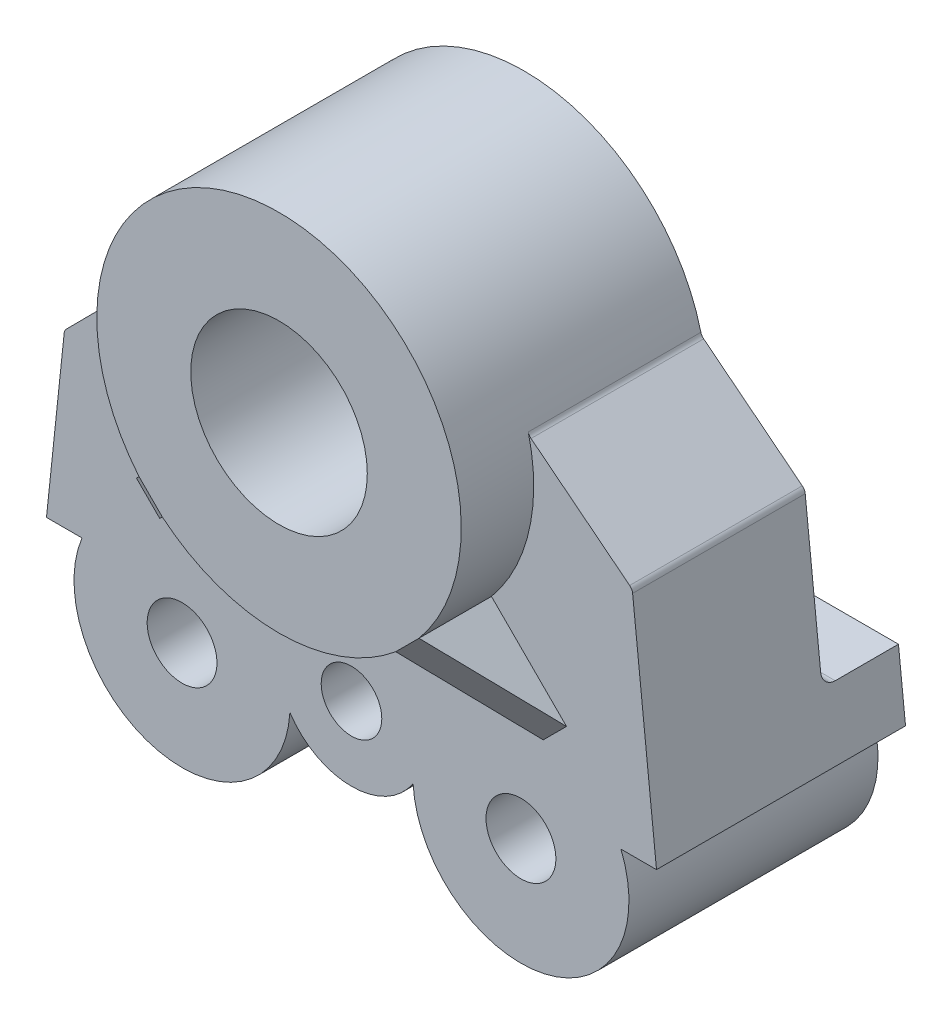
from build123d import *

# Parameters (mm, degrees)
SALIENTE_EXTRUIR1_DEPTH      = 6.7
SALIENTE_EXTRUIR1_DEPTH_BACK = 5.5
CORTAR_EXTRUIR1_REACH        = 25.161
CROQUIS3_R                   = 3.35
CROQUIS3_R_2                 = 2.69
CROQUIS3_R_3                 = 1.15
CORTAR_EXTRUIR3_START        = -2.9
CORTAR_EXTRUIR3_DEPTH        = 2.9
CORTAR_EXTRUIR4_DEPTH        = 2.75
CROQUIS7_R                   = 4.1
CROQUIS7_R_2                 = 1.325
SALIENTE_EXTRUIR2_DEPTH      = 2.03
REDONDEO3_R                  = 0.5
REDONDEO4_R                  = 0.3
REDONDEO5_START              = -2.75
REDONDEO5_DEPTH              = 6.55
REDONDEO6_R                  = 0.3
REDONDEO7_R                  = 0.3
SALIENTE_EXTRUIR3_START      = 2.75
SALIENTE_EXTRUIR3_DEPTH      = 2.75
CORTAR_EXTRUIR5_REACH        = 23.382
CORTAR_EXTRUIR6_REACH        = 23.382
CROQUIS11_W                  = 25.480274204
CROQUIS11_H                  = 24.941512188
CORTAR_EXTRUIR7_DEPTH        = 33


with BuildPart() as part:
    # Croquis2 → Saliente-Extruir1 (new, two sides: drawn at the far end of the back side and taken through both)
    with BuildSketch(Plane.XY.offset(-SALIENTE_EXTRUIR1_DEPTH_BACK)):
        with BuildLine():
            Line((11.575, -10.275), (10.225721275, -10.275))
            ThreePointArc((10.225721275, -10.275), (7.338229527, -15.823139458), (2.337147732, -12.066992374))
            ThreePointArc((2.337147732, -12.066992374), (0, -13.325), (-2.337147732, -12.066992374))
            ThreePointArc((-2.337147732, -12.066992374), (-7.338229527, -15.823139458), (-10.225721275, -10.275))
            Line((-10.225721275, -10.275), (-11.575, -10.275))
            Line((-11.575, -10.275), (-10.892429135, -3.780772023))
            Line((-10.892429135, -3.780772023), (-6.911230699, 0.228287594))
            ThreePointArc((-6.911230699, 0.228287594), (-0.680469648, 6.88143779), (6.732669496, 1.577462032))
            Line((6.732669496, 1.577462032), (10.655149523, -1.523207321))
            Line((10.655149523, -1.523207321), (11.575, -10.275))
        make_face()
    extrude(amount=SALIENTE_EXTRUIR1_DEPTH + SALIENTE_EXTRUIR1_DEPTH_BACK)

    # Croquis3 → Cortar-Extruir1 (cut, up to next)
    with BuildSketch(Plane.XY.offset(6.7), mode=Mode.PRIVATE) as cortar_extruir1_sk1:
        Circle(CROQUIS3_R)
    cortar_extruir1_tool1 = extrude(cortar_extruir1_sk1.sketch, amount=-CORTAR_EXTRUIR1_REACH, mode=Mode.PRIVATE) & part.part
    # Croquis3 → Cortar-Extruir1 (cut, up to next)
    with BuildSketch(Plane.XY.offset(6.7), mode=Mode.PRIVATE) as cortar_extruir1_sk2:
        with Locations((6.43, -11.825)):
            Circle(CROQUIS3_R_2)
    cortar_extruir1_tool2 = extrude(cortar_extruir1_sk2.sketch, amount=-CORTAR_EXTRUIR1_REACH, mode=Mode.PRIVATE) & part.part
    # Croquis3 → Cortar-Extruir1 (cut, up to next)
    with BuildSketch(Plane.XY.offset(6.7), mode=Mode.PRIVATE) as cortar_extruir1_sk3:
        with Locations((-6.43, -11.825)):
            Circle(CROQUIS3_R_2)
    cortar_extruir1_tool3 = extrude(cortar_extruir1_sk3.sketch, amount=-CORTAR_EXTRUIR1_REACH, mode=Mode.PRIVATE) & part.part
    # Croquis3 → Cortar-Extruir1 (cut, up to next)
    with BuildSketch(Plane.XY.offset(6.7), mode=Mode.PRIVATE) as cortar_extruir1_sk4:
        with Locations((0, -10.525)):
            Circle(CROQUIS3_R_3)
    cortar_extruir1_tool4 = extrude(cortar_extruir1_sk4.sketch, amount=-CORTAR_EXTRUIR1_REACH, mode=Mode.PRIVATE) & part.part
    add(cortar_extruir1_tool1.solids().sort_by_distance((0, 0, 6.7))[0], mode=Mode.SUBTRACT)
    add(cortar_extruir1_tool2.solids().sort_by_distance((6.43, -11.825, 6.7))[0], mode=Mode.SUBTRACT)
    add(cortar_extruir1_tool3.solids().sort_by_distance((-6.43, -11.825, 6.7))[0], mode=Mode.SUBTRACT)
    add(cortar_extruir1_tool4.solids().sort_by_distance((0, -10.525, 6.7))[0], mode=Mode.SUBTRACT)

    # Croquis4 → Cortar-Extruir3 (cut)
    with BuildSketch(Plane.XY.offset(6.7).offset(CORTAR_EXTRUIR3_START)):
        with BuildLine():
            Line((-11.3069842, -7.725), (11.3069842, -7.725))
            Line((11.3069842, -7.725), (10.655149523, -1.523207321))
            Line((10.655149523, -1.523207321), (6.732669496, 1.577462032))
            ThreePointArc((6.732669496, 1.577462032), (-0.680469648, 6.88143779), (-6.911230699, 0.228287594))
            Line((-6.911230699, 0.228287594), (-10.892429135, -3.780772023))
            Line((-10.892429135, -3.780772023), (-11.3069842, -7.725))
        make_face()
    extrude(amount=CORTAR_EXTRUIR3_DEPTH, mode=Mode.SUBTRACT)

    # Croquis6 → Cortar-Extruir4 (cut)
    with BuildSketch(Plane(origin=(0, 0, -5.5), x_dir=(-1, 0, 0), z_dir=(0, 0, -1))):
        with BuildLine():
            Line((-11.575, -10.275), (-11.3069842, -7.725))
            Line((-11.3069842, -7.725), (-10.655149523, -1.523207321))
            Line((-10.655149523, -1.523207321), (-6.732669496, 1.577462032))
            ThreePointArc((-6.732669496, 1.577462032), (-0.680469648, -6.88143779), (6.911230699, 0.228287594))
            Line((6.911230699, 0.228287594), (10.892429135, -3.780772023))
            Line((10.892429135, -3.780772023), (11.3069842, -7.725))
            Line((11.3069842, -7.725), (11.575, -10.275))
            Line((11.575, -10.275), (10.225721275, -10.275))
            ThreePointArc((10.225721275, -10.275), (7.338229527, -15.823139458), (2.337147732, -12.066992374))
            ThreePointArc((2.337147732, -12.066992374), (0, -13.325), (-2.337147732, -12.066992374))
            ThreePointArc((-2.337147732, -12.066992374), (-7.338229527, -15.823139458), (-10.225721275, -10.275))
            Line((-10.225721275, -10.275), (-11.575, -10.275))
        make_face()
    extrude(amount=-CORTAR_EXTRUIR4_DEPTH, mode=Mode.SUBTRACT)

    # Croquis7 → Saliente-Extruir2 (add)
    # profile 1 of 2: a face of its own
    with BuildSketch(Plane(origin=(0, 0, -2.75), x_dir=(-1, 0, 0), z_dir=(0, 0, -1))):
        with Locations((-6.43, -11.825)):
            Circle(CROQUIS7_R)
        with Locations((-6.43, -11.825)):
            Circle(CROQUIS7_R_2, mode=Mode.SUBTRACT)
    # profile 2 of 2: a face of its own
    with BuildSketch(Plane(origin=(0, 0, -2.75), x_dir=(-1, 0, 0), z_dir=(0, 0, -1))):
        with Locations((6.43, -11.825)):
            Circle(CROQUIS7_R)
        with Locations((6.43, -11.825)):
            Circle(CROQUIS7_R_2, mode=Mode.SUBTRACT)
    extrude(amount=-SALIENTE_EXTRUIR2_DEPTH)

    # Redondeo3
    redondeo3_edges = [part.edges().sort_by_distance(p)[0] for p in [
        (0, -7.725, 3.8),
    ]]
    fillet(redondeo3_edges, radius=REDONDEO3_R)

    # Redondeo4
    redondeo4_edges = [part.edges().sort_by_distance(p)[0] for p in [
        (10.655149523, -1.523207321, 0.525),
    ]]
    fillet(redondeo4_edges, radius=REDONDEO4_R)

    # Redondeo5: read off the stored shape, not the designer's step
    # Redondeo5 outline → Redondeo5 (add)
    with BuildSketch(Plane.XY.offset(REDONDEO5_START)):
        with BuildLine():
            ThreePointArc((6.813852263, 1.513288112), (6.747864412, 1.585904369), (6.708836606, 1.675928518))
            ThreePointArc((6.708836606, 1.675928518), (6.720933379, 1.626738922), (6.732669496, 1.577462032))
            Line((6.732669496, 1.577462032), (6.813852263, 1.513288112))
        make_face()
    extrude(amount=REDONDEO5_DEPTH)

    # Redondeo6
    redondeo6_edges = [part.edges().sort_by_distance(p)[0] for p in [
        (-10.892429135, -3.780772023, 0.525),
    ]]
    fillet(redondeo6_edges, radius=REDONDEO6_R)

    # Redondeo7
    # the kernel refuses this fillet: 0.3 mm, written as the material it adds along each edge
    with BuildSketch(Plane(origin=(-6.911230699, 0.228287594, -2.75), x_dir=(-0.7046368913074451, -0.7095680738368798, 0), z_dir=(0, 0, 1))) as redondeo7_piece_1:
        with BuildLine():
            CenterArc((0.116455714, -0.3), REDONDEO7_R, 90, 41.963687937)
            ThreePointArc((-0.084142134, -0.076929376), (-0.041912521, -0.038638099), (0, 0))
            Line((0, 0), (0.116455714, 0))
        make_face()
    extrude(amount=6.55)

    # Croquis8 → Saliente-Extruir3 (add)
    with BuildSketch(Plane(origin=(0, 0, -2.75), x_dir=(-1, 0, 0), z_dir=(0, 0, -1)).offset(SALIENTE_EXTRUIR3_START)):
        with BuildLine():
            Line((7.718070517, -7.718070517), (7.276128778, -8.160012255))
            Line((7.276128778, -8.160012255), (4.427688638, -5.311572114))
            ThreePointArc((4.427688638, -5.311572114), (4.889643392, -4.889643392), (5.311572114, -4.427688638))
            Line((5.311572114, -4.427688638), (8.160012255, -7.276128778))
            Line((8.160012255, -7.276128778), (7.718070517, -7.718070517))
        make_face()
        with BuildLine():
            Line((-7.718070517, -7.718070517), (-7.276128778, -8.160012255))
            Line((-7.276128778, -8.160012255), (-4.427688638, -5.311572114))
            ThreePointArc((-4.427688638, -5.311572114), (-4.889643392, -4.889643392), (-5.311572114, -4.427688638))
            Line((-5.311572114, -4.427688638), (-8.160012255, -7.276128778))
            Line((-8.160012255, -7.276128778), (-7.718070517, -7.718070517))
        make_face()
    extrude(amount=-SALIENTE_EXTRUIR3_DEPTH)

    # Croquis9 → Cortar-Extruir5 (cut, up to next)
    with BuildSketch(Plane(origin=(-0.441941738, 0.441941738, 0), x_dir=(0, 0, 1), z_dir=(-0.7071067811865471, 0.7071067811865479, 0)), mode=Mode.PRIVATE) as cortar_extruir5_sk1:
        Polygon((-5.5, -6.886697322), (-2.75, -10.915), (-5.5, -10.915), align=None)
    cortar_extruir5_tool1 = extrude(cortar_extruir5_sk1.sketch, amount=-CORTAR_EXTRUIR5_REACH, mode=Mode.PRIVATE) & part.part
    add(cortar_extruir5_tool1.solids().sort_by_distance((-7.210532, -6.326649, -4.583333))[0], mode=Mode.SUBTRACT)

    # Croquis10 → Cortar-Extruir6 (cut, up to next)
    with BuildSketch(Plane(origin=(0.441941738, 0.441941738, 0), x_dir=(0, 0, -1), z_dir=(0.7071067811865479, 0.7071067811865472, 0)), mode=Mode.PRIVATE) as cortar_extruir6_sk1:
        Polygon((2.75, -10.915), (5.5, -10.915), (5.5, -6.886697322), align=None)
    cortar_extruir6_tool1 = extrude(cortar_extruir6_sk1.sketch, amount=-CORTAR_EXTRUIR6_REACH, mode=Mode.PRIVATE) & part.part
    add(cortar_extruir6_tool1.solids().sort_by_distance((7.210532, -6.326649, -4.583333))[0], mode=Mode.SUBTRACT)


with BuildPart() as body_2:
    # Simetría5: mirrored copy
    add(part.part.mirror(Plane(origin=(0, 0, -15.5), x_dir=(1, 0, 0), z_dir=(0, 0, -1))))


with BuildPart() as part_1:
    add(part.part)

    # Croquis11 → Cortar-Extruir7 (cut)
    with BuildSketch(Plane(origin=(0, 0, -15.5), x_dir=(-1, 0, 0), z_dir=(0, 0, -1))):
        with Locations((-0.09507565, -4.82477955)):
            Rectangle(CROQUIS11_W, CROQUIS11_H)
    extrude(amount=-CORTAR_EXTRUIR7_DEPTH, mode=Mode.SUBTRACT)


solid = body_2.part
